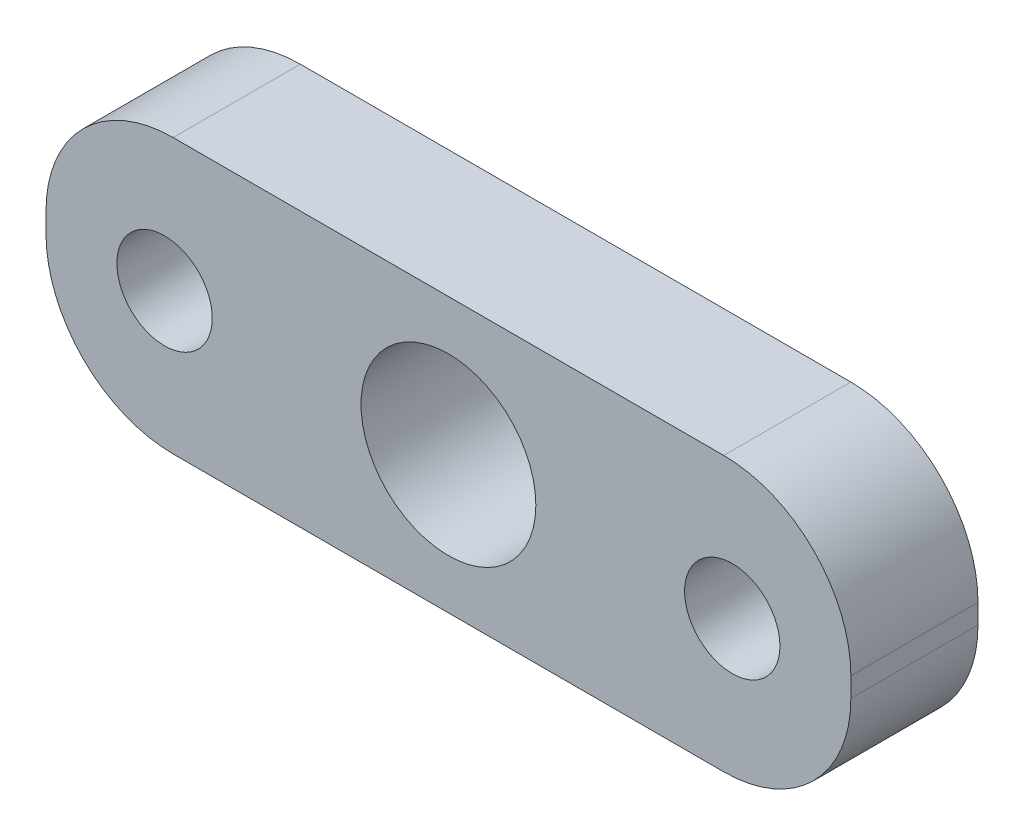
from build123d import *

# Parameters (mm, degrees)
SKETCH1_W           = 25.32
SKETCH1_H           = 8.62
SKETCH1_R           = 1.5
SKETCH1_R_2         = 2.75
BOSS_EXTRUDE1_DEPTH = 4
FILLET1_R           = 4


with BuildPart() as part:
    # Sketch1 → Boss-Extrude1 (new body)
    with BuildSketch(Plane.XY):
        Rectangle(SKETCH1_W, SKETCH1_H)
        with Locations((-8.93, 0)):
            Circle(SKETCH1_R, mode=Mode.SUBTRACT)
        with Locations((8.93, 0)):
            Circle(SKETCH1_R, mode=Mode.SUBTRACT)
        Circle(SKETCH1_R_2, mode=Mode.SUBTRACT)
    extrude(amount=BOSS_EXTRUDE1_DEPTH)

    # Fillet1
    fillet1_edges = [part.edges().sort_by_distance(p)[0] for p in [
        (12.66, -4.31, 2),
        (12.66, 4.31, 2),
        (-12.66, 4.31, 2),
        (-12.66, -4.31, 2),
    ]]
    fillet(fillet1_edges, radius=FILLET1_R)


solid = part.part
